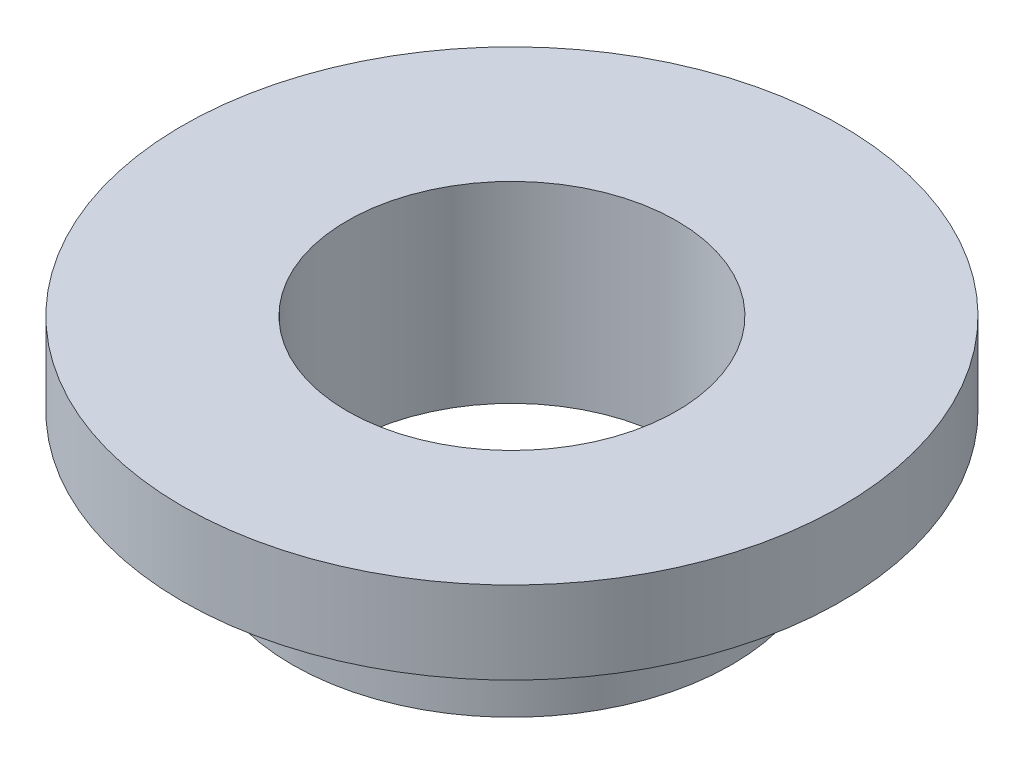
from build123d import *

# Parameters (mm, degrees)
SKETCH_1_R      = 8
SKETCH_1_R_2    = 6
EXTRUDE_1_DEPTH = 4
SKETCH_2_R      = 12
SKETCH_2_R_2    = 6
EXTRUDE_2_DEPTH = 3


with BuildPart() as part:
    # Эскиз1 → Вытянуть1 (new body)
    with BuildSketch(Plane(origin=(0, 0, 0), x_dir=(1, 0, 0), z_dir=(0, 1, 0))):
        Circle(SKETCH_1_R)
        Circle(SKETCH_1_R_2, mode=Mode.SUBTRACT)
    extrude(amount=EXTRUDE_1_DEPTH)

    # Эскиз2 → Вытянуть2 (add)
    with BuildSketch(Plane(origin=(0, 4, 0), x_dir=(-1, 0, 0), z_dir=(0, 1, 0))):
        Circle(SKETCH_2_R)
        Circle(SKETCH_2_R_2, mode=Mode.SUBTRACT)
    extrude(amount=EXTRUDE_2_DEPTH)


solid = part.part
